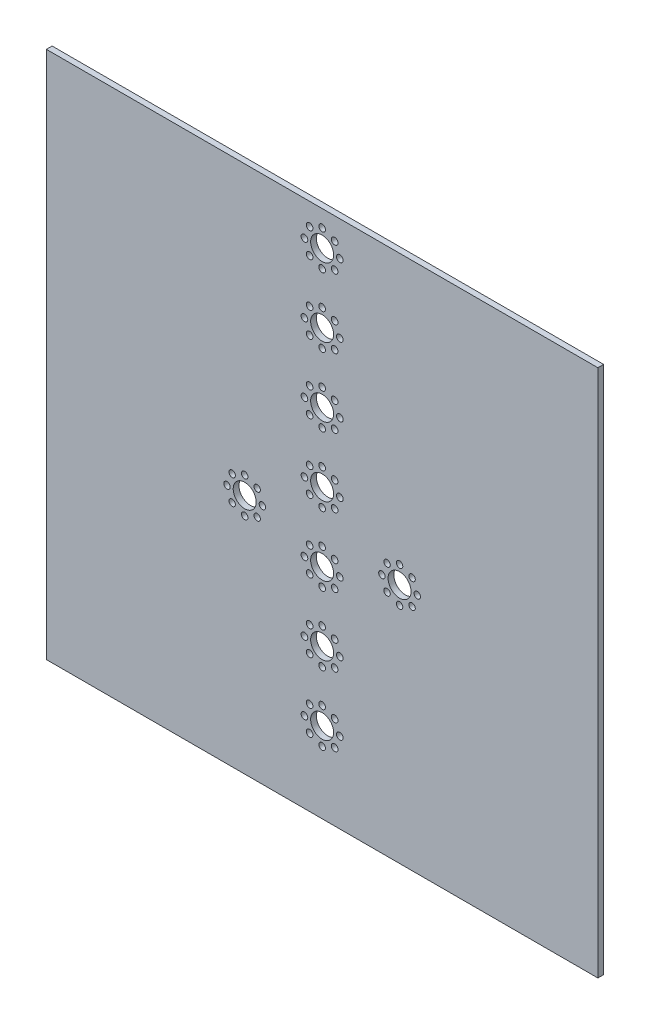
from build123d import *

# Parameters (mm, degrees)
SKETCH1_W                  = 304.8
SKETCH1_H                  = 292.1
BOSS_EXTRUDE1_DEPTH        = 3.175
SKETCH2_R                  = 1.778
CUT_EXTRUDE1_DEPTH         = 3.175
SKETCH3_R                  = 6.35
CUT_EXTRUDE2_DEPTH         = 3.175
CIRPATTERN1_COUNT          = 8
MIRROR2_COPY_1_SKETCH_R    = 1.778
MIRROR2_COPY_1_DEPTH       = 3.175
MIRROR2_COPY_2_SKETCH_R    = 1.778
MIRROR2_COPY_2_DEPTH       = 3.175
MIRROR2_COPY_3_SKETCH_R    = 1.778
MIRROR2_COPY_3_DEPTH       = 3.175
MIRROR2_COPY_4_SKETCH_R    = 1.778
MIRROR2_COPY_4_DEPTH       = 3.175
MIRROR2_COPY_5_SKETCH_R    = 1.778
MIRROR2_COPY_5_DEPTH       = 3.175
MIRROR2_COPY_6_SKETCH_R    = 1.778
MIRROR2_COPY_6_DEPTH       = 3.175
MIRROR2_COPY_7_SKETCH_R    = 1.778
MIRROR2_COPY_7_DEPTH       = 3.175
MIRROR2_COPY_8_SKETCH_R    = 1.778
MIRROR2_COPY_8_DEPTH       = 3.175
SKETCH4_R                  = 6.35
CUT_EXTRUDE3_DEPTH         = 3.175
SKETCH5_R                  = 1.8415
CUT_EXTRUDE4_DEPTH         = 3.175
CIRPATTERN2_COUNT          = 8
LPATTERN1_COUNT            = 7
LPATTERN1_PITCH            = 38.1
LPATTERN1_COPY_1_SKETCH_R  = 1.8415
LPATTERN1_COPY_1_DEPTH     = 3.175
LPATTERN1_COPY_2_SKETCH_R  = 1.8415
LPATTERN1_COPY_2_DEPTH     = 3.175
LPATTERN1_COPY_3_SKETCH_R  = 1.8415
LPATTERN1_COPY_3_DEPTH     = 3.175
LPATTERN1_COPY_4_SKETCH_R  = 1.8415
LPATTERN1_COPY_4_DEPTH     = 3.175
LPATTERN1_COPY_5_SKETCH_R  = 1.8415
LPATTERN1_COPY_5_DEPTH     = 3.175
LPATTERN1_COPY_6_SKETCH_R  = 1.8415
LPATTERN1_COPY_6_DEPTH     = 3.175
LPATTERN1_COPY_7_SKETCH_R  = 1.8415
LPATTERN1_COPY_7_DEPTH     = 3.175
LPATTERN1_COPY_8_SKETCH_R  = 1.8415
LPATTERN1_COPY_8_DEPTH     = 3.175
LPATTERN1_COPY_9_SKETCH_R  = 1.8415
LPATTERN1_COPY_9_DEPTH     = 3.175
LPATTERN1_COPY_10_SKETCH_R = 1.8415
LPATTERN1_COPY_10_DEPTH    = 3.175
LPATTERN1_COPY_11_SKETCH_R = 1.8415
LPATTERN1_COPY_11_DEPTH    = 3.175
LPATTERN1_COPY_12_SKETCH_R = 1.8415
LPATTERN1_COPY_12_DEPTH    = 3.175
LPATTERN1_COPY_13_SKETCH_R = 1.8415
LPATTERN1_COPY_13_DEPTH    = 3.175
LPATTERN1_COPY_14_SKETCH_R = 1.8415
LPATTERN1_COPY_14_DEPTH    = 3.175
LPATTERN1_COPY_15_SKETCH_R = 1.8415
LPATTERN1_COPY_15_DEPTH    = 3.175
LPATTERN1_COPY_16_SKETCH_R = 1.8415
LPATTERN1_COPY_16_DEPTH    = 3.175
LPATTERN1_COPY_17_SKETCH_R = 1.8415
LPATTERN1_COPY_17_DEPTH    = 3.175
LPATTERN1_COPY_18_SKETCH_R = 1.8415
LPATTERN1_COPY_18_DEPTH    = 3.175
LPATTERN1_COPY_19_SKETCH_R = 1.8415
LPATTERN1_COPY_19_DEPTH    = 3.175
LPATTERN1_COPY_20_SKETCH_R = 1.8415
LPATTERN1_COPY_20_DEPTH    = 3.175
LPATTERN1_COPY_21_SKETCH_R = 1.8415
LPATTERN1_COPY_21_DEPTH    = 3.175
LPATTERN1_COPY_22_SKETCH_R = 1.8415
LPATTERN1_COPY_22_DEPTH    = 3.175
LPATTERN1_COPY_23_SKETCH_R = 1.8415
LPATTERN1_COPY_23_DEPTH    = 3.175
LPATTERN1_COPY_24_SKETCH_R = 1.8415
LPATTERN1_COPY_24_DEPTH    = 3.175
LPATTERN1_COPY_25_SKETCH_R = 1.8415
LPATTERN1_COPY_25_DEPTH    = 3.175
LPATTERN1_COPY_26_SKETCH_R = 1.8415
LPATTERN1_COPY_26_DEPTH    = 3.175
LPATTERN1_COPY_27_SKETCH_R = 1.8415
LPATTERN1_COPY_27_DEPTH    = 3.175
LPATTERN1_COPY_28_SKETCH_R = 1.8415
LPATTERN1_COPY_28_DEPTH    = 3.175
LPATTERN1_COPY_29_SKETCH_R = 1.8415
LPATTERN1_COPY_29_DEPTH    = 3.175
LPATTERN1_COPY_30_SKETCH_R = 1.8415
LPATTERN1_COPY_30_DEPTH    = 3.175
LPATTERN1_COPY_31_SKETCH_R = 1.8415
LPATTERN1_COPY_31_DEPTH    = 3.175
LPATTERN1_COPY_32_SKETCH_R = 1.8415
LPATTERN1_COPY_32_DEPTH    = 3.175
LPATTERN1_COPY_33_SKETCH_R = 1.8415
LPATTERN1_COPY_33_DEPTH    = 3.175
LPATTERN1_COPY_34_SKETCH_R = 1.8415
LPATTERN1_COPY_34_DEPTH    = 3.175
LPATTERN1_COPY_35_SKETCH_R = 1.8415
LPATTERN1_COPY_35_DEPTH    = 3.175
LPATTERN1_COPY_36_SKETCH_R = 1.8415
LPATTERN1_COPY_36_DEPTH    = 3.175
LPATTERN1_COPY_37_SKETCH_R = 1.8415
LPATTERN1_COPY_37_DEPTH    = 3.175
LPATTERN1_COPY_38_SKETCH_R = 1.8415
LPATTERN1_COPY_38_DEPTH    = 3.175
LPATTERN1_COPY_39_SKETCH_R = 1.8415
LPATTERN1_COPY_39_DEPTH    = 3.175
LPATTERN1_COPY_40_SKETCH_R = 1.8415
LPATTERN1_COPY_40_DEPTH    = 3.175
LPATTERN1_COPY_41_SKETCH_R = 1.8415
LPATTERN1_COPY_41_DEPTH    = 3.175
LPATTERN1_COPY_42_SKETCH_R = 1.8415
LPATTERN1_COPY_42_DEPTH    = 3.175
LPATTERN1_COPY_43_SKETCH_R = 1.8415
LPATTERN1_COPY_43_DEPTH    = 3.175
LPATTERN1_COPY_44_SKETCH_R = 1.8415
LPATTERN1_COPY_44_DEPTH    = 3.175
LPATTERN1_COPY_45_SKETCH_R = 1.8415
LPATTERN1_COPY_45_DEPTH    = 3.175
LPATTERN1_COPY_46_SKETCH_R = 1.8415
LPATTERN1_COPY_46_DEPTH    = 3.175
LPATTERN1_COPY_47_SKETCH_R = 1.8415
LPATTERN1_COPY_47_DEPTH    = 3.175
LPATTERN1_COPY_48_SKETCH_R = 1.8415
LPATTERN1_COPY_48_DEPTH    = 3.175


with BuildPart() as part:
    # Sketch1 → Boss-Extrude1 (new body)
    with BuildSketch(Plane.XY):
        with Locations((-152.4, -146.05)):
            Rectangle(SKETCH1_W, SKETCH1_H)
    extrude(amount=BOSS_EXTRUDE1_DEPTH)

    # Sketch2 → Cut-Extrude1 (cut)
    with BuildSketch(Plane(origin=(0, 0, 0), x_dir=(-1, 0, 0), z_dir=(0, 0, -1))):
        with Locations((99.822, -158.75)):
            Circle(SKETCH2_R)
    cut_extrude1 = extrude(amount=-CUT_EXTRUDE1_DEPTH, mode=Mode.SUBTRACT)

    # Mirror1: Cut-Extrude1 across plane
    add(cut_extrude1.mirror(Plane(origin=(-152.4, 0, 0), x_dir=(0, 0, 1), z_dir=(1, 0, 0))), mode=Mode.SUBTRACT)

    # Sketch3 → Cut-Extrude2 (cut)
    with BuildSketch(Plane(origin=(0, 0, 0), x_dir=(-1, 0, 0), z_dir=(0, 0, -1))):
        with Locations((109.601, -158.75)):
            Circle(SKETCH3_R)
    cut_extrude2 = extrude(amount=-CUT_EXTRUDE2_DEPTH, mode=Mode.SUBTRACT)

    # CirPattern1: Cut-Extrude1 ×8 about axis
    cirpattern1_axis = Axis((-109.601, -158.75, 0), (0, 0, -1))
    for i in range(1, CIRPATTERN1_COUNT):
        add(cut_extrude1.rotate(cirpattern1_axis, i * 360 / CIRPATTERN1_COUNT), mode=Mode.SUBTRACT)

    # Mirror2: Cut-Extrude2 across plane
    add(cut_extrude2.mirror(Plane(origin=(-152.4, 0, 0), x_dir=(0, 0, 1), z_dir=(1, 0, 0))), mode=Mode.SUBTRACT)

    # Mirror2 copy 1 sketch → Mirror2 copy 1 (cut)
    with BuildSketch(Plane(origin=(-384.951811838, -123.996408811, 0), x_dir=(0.7071067811865478, 0.7071067811865472, 0), z_dir=(0, 0, -1))):
        with Locations((99.822, 158.75)):
            Circle(MIRROR2_COPY_1_SKETCH_R)
    extrude(amount=-MIRROR2_COPY_1_DEPTH, mode=Mode.SUBTRACT)

    # Mirror2 copy 2 sketch → Mirror2 copy 2 (cut)
    with BuildSketch(Plane(origin=(-353.949, -268.351, 0), x_dir=(0, 1, 0), z_dir=(0, 0, -1))):
        with Locations((99.822, 158.75)):
            Circle(MIRROR2_COPY_2_SKETCH_R)
    extrude(amount=-MIRROR2_COPY_2_DEPTH, mode=Mode.SUBTRACT)

    # Mirror2 copy 3 sketch → Mirror2 copy 3 (cut)
    with BuildSketch(Plane(origin=(-229.952591189, -348.502811838, 0), x_dir=(-0.7071067811865472, 0.7071067811865478, 0), z_dir=(0, 0, -1))):
        with Locations((99.822, 158.75)):
            Circle(MIRROR2_COPY_3_SKETCH_R)
    extrude(amount=-MIRROR2_COPY_3_DEPTH, mode=Mode.SUBTRACT)

    # Mirror2 copy 4 sketch → Mirror2 copy 4 (cut)
    with BuildSketch(Plane(origin=(-85.598, -317.5, 0), x_dir=(-1, 0, 0), z_dir=(0, 0, -1))):
        with Locations((99.822, 158.75)):
            Circle(MIRROR2_COPY_4_SKETCH_R)
    extrude(amount=-MIRROR2_COPY_4_DEPTH, mode=Mode.SUBTRACT)

    # Mirror2 copy 5 sketch → Mirror2 copy 5 (cut)
    with BuildSketch(Plane(origin=(-5.446188162, -193.503591189, 0), x_dir=(-0.7071067811865479, -0.7071067811865472, 0), z_dir=(0, 0, -1))):
        with Locations((99.822, 158.75)):
            Circle(MIRROR2_COPY_5_SKETCH_R)
    extrude(amount=-MIRROR2_COPY_5_DEPTH, mode=Mode.SUBTRACT)

    # Mirror2 copy 6 sketch → Mirror2 copy 6 (cut)
    with BuildSketch(Plane(origin=(-36.449, -49.149, 0), x_dir=(0, -1, 0), z_dir=(0, 0, -1))):
        with Locations((99.822, 158.75)):
            Circle(MIRROR2_COPY_6_SKETCH_R)
    extrude(amount=-MIRROR2_COPY_6_DEPTH, mode=Mode.SUBTRACT)

    # Mirror2 copy 7 sketch → Mirror2 copy 7 (cut)
    with BuildSketch(Plane(origin=(-160.445408811, 31.002811838, 0), x_dir=(0.7071067811865471, -0.7071067811865479, 0), z_dir=(0, 0, -1))):
        with Locations((99.822, 158.75)):
            Circle(MIRROR2_COPY_7_SKETCH_R)
    extrude(amount=-MIRROR2_COPY_7_DEPTH, mode=Mode.SUBTRACT)

    # Mirror2 copy 8 sketch → Mirror2 copy 8 (cut)
    with BuildSketch(Plane(origin=(-304.8, 0, 0), x_dir=(1, 0, 0), z_dir=(0, 0, -1))):
        with Locations((99.822, 158.75)):
            Circle(MIRROR2_COPY_8_SKETCH_R)
    extrude(amount=-MIRROR2_COPY_8_DEPTH, mode=Mode.SUBTRACT)

    # Sketch4 → Cut-Extrude3 (cut)
    with BuildSketch(Plane(origin=(0, 0, 0), x_dir=(-1, 0, 0), z_dir=(0, 0, -1))):
        with Locations((152.4, -19.05)):
            Circle(SKETCH4_R)
    cut_extrude3 = extrude(amount=-CUT_EXTRUDE3_DEPTH, mode=Mode.SUBTRACT)

    # Sketch5 → Cut-Extrude4 (cut)
    with BuildSketch(Plane(origin=(0, 0, 0), x_dir=(-1, 0, 0), z_dir=(0, 0, -1))):
        with Locations((152.4, -9.271)):
            Circle(SKETCH5_R)
    cut_extrude4 = extrude(amount=-CUT_EXTRUDE4_DEPTH, mode=Mode.SUBTRACT)

    # CirPattern2: Cut-Extrude4 ×8 about axis
    cirpattern2_axis = Axis((-152.4, -19.05, 0), (0, 0, -1))
    for i in range(1, CIRPATTERN2_COUNT):
        add(cut_extrude4.rotate(cirpattern2_axis, i * 360 / CIRPATTERN2_COUNT), mode=Mode.SUBTRACT)

    # LPattern1: Cut-Extrude3 ×7
    with Locations(*[(0, -i * LPATTERN1_PITCH, 0) for i in range(1, LPATTERN1_COUNT)]):
        add(cut_extrude3, mode=Mode.SUBTRACT)

    # LPattern1 copy 1 sketch → LPattern1 copy 1 (cut)
    with BuildSketch(Plane(origin=(-31.166542366, -151.442689271, 0), x_dir=(-0.7071067811865476, 0.7071067811865475, 0), z_dir=(0, 0, -1))):
        with Locations((152.4, -9.271)):
            Circle(LPATTERN1_COPY_1_SKETCH_R)
    extrude(amount=-LPATTERN1_COPY_1_DEPTH, mode=Mode.SUBTRACT)

    # LPattern1 copy 2 sketch → LPattern1 copy 2 (cut)
    with BuildSketch(Plane(origin=(-31.166542366, -189.542689271, 0), x_dir=(-0.7071067811865476, 0.7071067811865475, 0), z_dir=(0, 0, -1))):
        with Locations((152.4, -9.271)):
            Circle(LPATTERN1_COPY_2_SKETCH_R)
    extrude(amount=-LPATTERN1_COPY_2_DEPTH, mode=Mode.SUBTRACT)

    # LPattern1 copy 3 sketch → LPattern1 copy 3 (cut)
    with BuildSketch(Plane(origin=(-31.166542366, -227.642689271, 0), x_dir=(-0.7071067811865476, 0.7071067811865475, 0), z_dir=(0, 0, -1))):
        with Locations((152.4, -9.271)):
            Circle(LPATTERN1_COPY_3_SKETCH_R)
    extrude(amount=-LPATTERN1_COPY_3_DEPTH, mode=Mode.SUBTRACT)

    # LPattern1 copy 4 sketch → LPattern1 copy 4 (cut)
    with BuildSketch(Plane(origin=(-31.166542366, -265.742689271, 0), x_dir=(-0.7071067811865476, 0.7071067811865475, 0), z_dir=(0, 0, -1))):
        with Locations((152.4, -9.271)):
            Circle(LPATTERN1_COPY_4_SKETCH_R)
    extrude(amount=-LPATTERN1_COPY_4_DEPTH, mode=Mode.SUBTRACT)

    # LPattern1 copy 5 sketch → LPattern1 copy 5 (cut)
    with BuildSketch(Plane(origin=(-31.166542366, -303.842689271, 0), x_dir=(-0.7071067811865476, 0.7071067811865475, 0), z_dir=(0, 0, -1))):
        with Locations((152.4, -9.271)):
            Circle(LPATTERN1_COPY_5_SKETCH_R)
    extrude(amount=-LPATTERN1_COPY_5_DEPTH, mode=Mode.SUBTRACT)

    # LPattern1 copy 6 sketch → LPattern1 copy 6 (cut)
    with BuildSketch(Plane(origin=(-31.166542366, -341.942689271, 0), x_dir=(-0.7071067811865476, 0.7071067811865475, 0), z_dir=(0, 0, -1))):
        with Locations((152.4, -9.271)):
            Circle(LPATTERN1_COPY_6_SKETCH_R)
    extrude(amount=-LPATTERN1_COPY_6_DEPTH, mode=Mode.SUBTRACT)

    # LPattern1 copy 7 sketch → LPattern1 copy 7 (cut)
    with BuildSketch(Plane(origin=(-133.35, -209.55, 0), x_dir=(0, 1, 0), z_dir=(0, 0, -1))):
        with Locations((152.4, -9.271)):
            Circle(LPATTERN1_COPY_7_SKETCH_R)
    extrude(amount=-LPATTERN1_COPY_7_DEPTH, mode=Mode.SUBTRACT)

    # LPattern1 copy 8 sketch → LPattern1 copy 8 (cut)
    with BuildSketch(Plane(origin=(-133.35, -247.65, 0), x_dir=(0, 1, 0), z_dir=(0, 0, -1))):
        with Locations((152.4, -9.271)):
            Circle(LPATTERN1_COPY_8_SKETCH_R)
    extrude(amount=-LPATTERN1_COPY_8_DEPTH, mode=Mode.SUBTRACT)

    # LPattern1 copy 9 sketch → LPattern1 copy 9 (cut)
    with BuildSketch(Plane(origin=(-133.35, -285.75, 0), x_dir=(0, 1, 0), z_dir=(0, 0, -1))):
        with Locations((152.4, -9.271)):
            Circle(LPATTERN1_COPY_9_SKETCH_R)
    extrude(amount=-LPATTERN1_COPY_9_DEPTH, mode=Mode.SUBTRACT)

    # LPattern1 copy 10 sketch → LPattern1 copy 10 (cut)
    with BuildSketch(Plane(origin=(-133.35, -323.85, 0), x_dir=(0, 1, 0), z_dir=(0, 0, -1))):
        with Locations((152.4, -9.271)):
            Circle(LPATTERN1_COPY_10_SKETCH_R)
    extrude(amount=-LPATTERN1_COPY_10_DEPTH, mode=Mode.SUBTRACT)

    # LPattern1 copy 11 sketch → LPattern1 copy 11 (cut)
    with BuildSketch(Plane(origin=(-133.35, -361.95, 0), x_dir=(0, 1, 0), z_dir=(0, 0, -1))):
        with Locations((152.4, -9.271)):
            Circle(LPATTERN1_COPY_11_SKETCH_R)
    extrude(amount=-LPATTERN1_COPY_11_DEPTH, mode=Mode.SUBTRACT)

    # LPattern1 copy 12 sketch → LPattern1 copy 12 (cut)
    with BuildSketch(Plane(origin=(-133.35, -400.05, 0), x_dir=(0, 1, 0), z_dir=(0, 0, -1))):
        with Locations((152.4, -9.271)):
            Circle(LPATTERN1_COPY_12_SKETCH_R)
    extrude(amount=-LPATTERN1_COPY_12_DEPTH, mode=Mode.SUBTRACT)

    # LPattern1 copy 13 sketch → LPattern1 copy 13 (cut)
    with BuildSketch(Plane(origin=(-246.692689271, -178.383457634, 0), x_dir=(0.7071067811865475, 0.7071067811865476, 0), z_dir=(0, 0, -1))):
        with Locations((152.4, -9.271)):
            Circle(LPATTERN1_COPY_13_SKETCH_R)
    extrude(amount=-LPATTERN1_COPY_13_DEPTH, mode=Mode.SUBTRACT)

    # LPattern1 copy 14 sketch → LPattern1 copy 14 (cut)
    with BuildSketch(Plane(origin=(-246.692689271, -216.483457634, 0), x_dir=(0.7071067811865475, 0.7071067811865476, 0), z_dir=(0, 0, -1))):
        with Locations((152.4, -9.271)):
            Circle(LPATTERN1_COPY_14_SKETCH_R)
    extrude(amount=-LPATTERN1_COPY_14_DEPTH, mode=Mode.SUBTRACT)

    # LPattern1 copy 15 sketch → LPattern1 copy 15 (cut)
    with BuildSketch(Plane(origin=(-246.692689271, -254.583457634, 0), x_dir=(0.7071067811865475, 0.7071067811865476, 0), z_dir=(0, 0, -1))):
        with Locations((152.4, -9.271)):
            Circle(LPATTERN1_COPY_15_SKETCH_R)
    extrude(amount=-LPATTERN1_COPY_15_DEPTH, mode=Mode.SUBTRACT)

    # LPattern1 copy 16 sketch → LPattern1 copy 16 (cut)
    with BuildSketch(Plane(origin=(-246.692689271, -292.683457634, 0), x_dir=(0.7071067811865475, 0.7071067811865476, 0), z_dir=(0, 0, -1))):
        with Locations((152.4, -9.271)):
            Circle(LPATTERN1_COPY_16_SKETCH_R)
    extrude(amount=-LPATTERN1_COPY_16_DEPTH, mode=Mode.SUBTRACT)

    # LPattern1 copy 17 sketch → LPattern1 copy 17 (cut)
    with BuildSketch(Plane(origin=(-246.692689271, -330.783457634, 0), x_dir=(0.7071067811865475, 0.7071067811865476, 0), z_dir=(0, 0, -1))):
        with Locations((152.4, -9.271)):
            Circle(LPATTERN1_COPY_17_SKETCH_R)
    extrude(amount=-LPATTERN1_COPY_17_DEPTH, mode=Mode.SUBTRACT)

    # LPattern1 copy 18 sketch → LPattern1 copy 18 (cut)
    with BuildSketch(Plane(origin=(-246.692689271, -368.883457634, 0), x_dir=(0.7071067811865475, 0.7071067811865476, 0), z_dir=(0, 0, -1))):
        with Locations((152.4, -9.271)):
            Circle(LPATTERN1_COPY_18_SKETCH_R)
    extrude(amount=-LPATTERN1_COPY_18_DEPTH, mode=Mode.SUBTRACT)

    # LPattern1 copy 19 sketch → LPattern1 copy 19 (cut)
    with BuildSketch(Plane(origin=(-304.8, -76.2, 0), x_dir=(1, 0, 0), z_dir=(0, 0, -1))):
        with Locations((152.4, -9.271)):
            Circle(LPATTERN1_COPY_19_SKETCH_R)
    extrude(amount=-LPATTERN1_COPY_19_DEPTH, mode=Mode.SUBTRACT)

    # LPattern1 copy 20 sketch → LPattern1 copy 20 (cut)
    with BuildSketch(Plane(origin=(-304.8, -114.3, 0), x_dir=(1, 0, 0), z_dir=(0, 0, -1))):
        with Locations((152.4, -9.271)):
            Circle(LPATTERN1_COPY_20_SKETCH_R)
    extrude(amount=-LPATTERN1_COPY_20_DEPTH, mode=Mode.SUBTRACT)

    # LPattern1 copy 21 sketch → LPattern1 copy 21 (cut)
    with BuildSketch(Plane(origin=(-304.8, -152.4, 0), x_dir=(1, 0, 0), z_dir=(0, 0, -1))):
        with Locations((152.4, -9.271)):
            Circle(LPATTERN1_COPY_21_SKETCH_R)
    extrude(amount=-LPATTERN1_COPY_21_DEPTH, mode=Mode.SUBTRACT)

    # LPattern1 copy 22 sketch → LPattern1 copy 22 (cut)
    with BuildSketch(Plane(origin=(-304.8, -190.5, 0), x_dir=(1, 0, 0), z_dir=(0, 0, -1))):
        with Locations((152.4, -9.271)):
            Circle(LPATTERN1_COPY_22_SKETCH_R)
    extrude(amount=-LPATTERN1_COPY_22_DEPTH, mode=Mode.SUBTRACT)

    # LPattern1 copy 23 sketch → LPattern1 copy 23 (cut)
    with BuildSketch(Plane(origin=(-304.8, -228.6, 0), x_dir=(1, 0, 0), z_dir=(0, 0, -1))):
        with Locations((152.4, -9.271)):
            Circle(LPATTERN1_COPY_23_SKETCH_R)
    extrude(amount=-LPATTERN1_COPY_23_DEPTH, mode=Mode.SUBTRACT)

    # LPattern1 copy 24 sketch → LPattern1 copy 24 (cut)
    with BuildSketch(Plane(origin=(-304.8, -266.7, 0), x_dir=(1, 0, 0), z_dir=(0, 0, -1))):
        with Locations((152.4, -9.271)):
            Circle(LPATTERN1_COPY_24_SKETCH_R)
    extrude(amount=-LPATTERN1_COPY_24_DEPTH, mode=Mode.SUBTRACT)

    # LPattern1 copy 25 sketch → LPattern1 copy 25 (cut)
    with BuildSketch(Plane(origin=(-273.633457634, 37.142689271, 0), x_dir=(0.7071067811865477, -0.7071067811865475, 0), z_dir=(0, 0, -1))):
        with Locations((152.4, -9.271)):
            Circle(LPATTERN1_COPY_25_SKETCH_R)
    extrude(amount=-LPATTERN1_COPY_25_DEPTH, mode=Mode.SUBTRACT)

    # LPattern1 copy 26 sketch → LPattern1 copy 26 (cut)
    with BuildSketch(Plane(origin=(-273.633457634, -0.957310729, 0), x_dir=(0.7071067811865477, -0.7071067811865475, 0), z_dir=(0, 0, -1))):
        with Locations((152.4, -9.271)):
            Circle(LPATTERN1_COPY_26_SKETCH_R)
    extrude(amount=-LPATTERN1_COPY_26_DEPTH, mode=Mode.SUBTRACT)

    # LPattern1 copy 27 sketch → LPattern1 copy 27 (cut)
    with BuildSketch(Plane(origin=(-273.633457634, -39.057310729, 0), x_dir=(0.7071067811865477, -0.7071067811865475, 0), z_dir=(0, 0, -1))):
        with Locations((152.4, -9.271)):
            Circle(LPATTERN1_COPY_27_SKETCH_R)
    extrude(amount=-LPATTERN1_COPY_27_DEPTH, mode=Mode.SUBTRACT)

    # LPattern1 copy 28 sketch → LPattern1 copy 28 (cut)
    with BuildSketch(Plane(origin=(-273.633457634, -77.157310729, 0), x_dir=(0.7071067811865477, -0.7071067811865475, 0), z_dir=(0, 0, -1))):
        with Locations((152.4, -9.271)):
            Circle(LPATTERN1_COPY_28_SKETCH_R)
    extrude(amount=-LPATTERN1_COPY_28_DEPTH, mode=Mode.SUBTRACT)

    # LPattern1 copy 29 sketch → LPattern1 copy 29 (cut)
    with BuildSketch(Plane(origin=(-273.633457634, -115.257310729, 0), x_dir=(0.7071067811865477, -0.7071067811865475, 0), z_dir=(0, 0, -1))):
        with Locations((152.4, -9.271)):
            Circle(LPATTERN1_COPY_29_SKETCH_R)
    extrude(amount=-LPATTERN1_COPY_29_DEPTH, mode=Mode.SUBTRACT)

    # LPattern1 copy 30 sketch → LPattern1 copy 30 (cut)
    with BuildSketch(Plane(origin=(-273.633457634, -153.357310729, 0), x_dir=(0.7071067811865477, -0.7071067811865475, 0), z_dir=(0, 0, -1))):
        with Locations((152.4, -9.271)):
            Circle(LPATTERN1_COPY_30_SKETCH_R)
    extrude(amount=-LPATTERN1_COPY_30_DEPTH, mode=Mode.SUBTRACT)

    # LPattern1 copy 31 sketch → LPattern1 copy 31 (cut)
    with BuildSketch(Plane(origin=(-171.45, 95.25, 0), x_dir=(0, -1, 0), z_dir=(0, 0, -1))):
        with Locations((152.4, -9.271)):
            Circle(LPATTERN1_COPY_31_SKETCH_R)
    extrude(amount=-LPATTERN1_COPY_31_DEPTH, mode=Mode.SUBTRACT)

    # LPattern1 copy 32 sketch → LPattern1 copy 32 (cut)
    with BuildSketch(Plane(origin=(-171.45, 57.15, 0), x_dir=(0, -1, 0), z_dir=(0, 0, -1))):
        with Locations((152.4, -9.271)):
            Circle(LPATTERN1_COPY_32_SKETCH_R)
    extrude(amount=-LPATTERN1_COPY_32_DEPTH, mode=Mode.SUBTRACT)

    # LPattern1 copy 33 sketch → LPattern1 copy 33 (cut)
    with BuildSketch(Plane(origin=(-171.45, 19.05, 0), x_dir=(0, -1, 0), z_dir=(0, 0, -1))):
        with Locations((152.4, -9.271)):
            Circle(LPATTERN1_COPY_33_SKETCH_R)
    extrude(amount=-LPATTERN1_COPY_33_DEPTH, mode=Mode.SUBTRACT)

    # LPattern1 copy 34 sketch → LPattern1 copy 34 (cut)
    with BuildSketch(Plane(origin=(-171.45, -19.05, 0), x_dir=(0, -1, 0), z_dir=(0, 0, -1))):
        with Locations((152.4, -9.271)):
            Circle(LPATTERN1_COPY_34_SKETCH_R)
    extrude(amount=-LPATTERN1_COPY_34_DEPTH, mode=Mode.SUBTRACT)

    # LPattern1 copy 35 sketch → LPattern1 copy 35 (cut)
    with BuildSketch(Plane(origin=(-171.45, -57.15, 0), x_dir=(0, -1, 0), z_dir=(0, 0, -1))):
        with Locations((152.4, -9.271)):
            Circle(LPATTERN1_COPY_35_SKETCH_R)
    extrude(amount=-LPATTERN1_COPY_35_DEPTH, mode=Mode.SUBTRACT)

    # LPattern1 copy 36 sketch → LPattern1 copy 36 (cut)
    with BuildSketch(Plane(origin=(-171.45, -95.25, 0), x_dir=(0, -1, 0), z_dir=(0, 0, -1))):
        with Locations((152.4, -9.271)):
            Circle(LPATTERN1_COPY_36_SKETCH_R)
    extrude(amount=-LPATTERN1_COPY_36_DEPTH, mode=Mode.SUBTRACT)

    # LPattern1 copy 37 sketch → LPattern1 copy 37 (cut)
    with BuildSketch(Plane(origin=(-58.107310729, 64.083457634, 0), x_dir=(-0.7071067811865474, -0.7071067811865477, 0), z_dir=(0, 0, -1))):
        with Locations((152.4, -9.271)):
            Circle(LPATTERN1_COPY_37_SKETCH_R)
    extrude(amount=-LPATTERN1_COPY_37_DEPTH, mode=Mode.SUBTRACT)

    # LPattern1 copy 38 sketch → LPattern1 copy 38 (cut)
    with BuildSketch(Plane(origin=(-58.107310729, 25.983457634, 0), x_dir=(-0.7071067811865474, -0.7071067811865477, 0), z_dir=(0, 0, -1))):
        with Locations((152.4, -9.271)):
            Circle(LPATTERN1_COPY_38_SKETCH_R)
    extrude(amount=-LPATTERN1_COPY_38_DEPTH, mode=Mode.SUBTRACT)

    # LPattern1 copy 39 sketch → LPattern1 copy 39 (cut)
    with BuildSketch(Plane(origin=(-58.107310729, -12.116542366, 0), x_dir=(-0.7071067811865474, -0.7071067811865477, 0), z_dir=(0, 0, -1))):
        with Locations((152.4, -9.271)):
            Circle(LPATTERN1_COPY_39_SKETCH_R)
    extrude(amount=-LPATTERN1_COPY_39_DEPTH, mode=Mode.SUBTRACT)

    # LPattern1 copy 40 sketch → LPattern1 copy 40 (cut)
    with BuildSketch(Plane(origin=(-58.107310729, -50.216542366, 0), x_dir=(-0.7071067811865474, -0.7071067811865477, 0), z_dir=(0, 0, -1))):
        with Locations((152.4, -9.271)):
            Circle(LPATTERN1_COPY_40_SKETCH_R)
    extrude(amount=-LPATTERN1_COPY_40_DEPTH, mode=Mode.SUBTRACT)

    # LPattern1 copy 41 sketch → LPattern1 copy 41 (cut)
    with BuildSketch(Plane(origin=(-58.107310729, -88.316542366, 0), x_dir=(-0.7071067811865474, -0.7071067811865477, 0), z_dir=(0, 0, -1))):
        with Locations((152.4, -9.271)):
            Circle(LPATTERN1_COPY_41_SKETCH_R)
    extrude(amount=-LPATTERN1_COPY_41_DEPTH, mode=Mode.SUBTRACT)

    # LPattern1 copy 42 sketch → LPattern1 copy 42 (cut)
    with BuildSketch(Plane(origin=(-58.107310729, -126.416542366, 0), x_dir=(-0.7071067811865474, -0.7071067811865477, 0), z_dir=(0, 0, -1))):
        with Locations((152.4, -9.271)):
            Circle(LPATTERN1_COPY_42_SKETCH_R)
    extrude(amount=-LPATTERN1_COPY_42_DEPTH, mode=Mode.SUBTRACT)

    # LPattern1 copy 43 sketch → LPattern1 copy 43 (cut)
    with BuildSketch(Plane(origin=(0, -38.1, 0), x_dir=(-1, 0, 0), z_dir=(0, 0, -1))):
        with Locations((152.4, -9.271)):
            Circle(LPATTERN1_COPY_43_SKETCH_R)
    extrude(amount=-LPATTERN1_COPY_43_DEPTH, mode=Mode.SUBTRACT)

    # LPattern1 copy 44 sketch → LPattern1 copy 44 (cut)
    with BuildSketch(Plane(origin=(0, -76.2, 0), x_dir=(-1, 0, 0), z_dir=(0, 0, -1))):
        with Locations((152.4, -9.271)):
            Circle(LPATTERN1_COPY_44_SKETCH_R)
    extrude(amount=-LPATTERN1_COPY_44_DEPTH, mode=Mode.SUBTRACT)

    # LPattern1 copy 45 sketch → LPattern1 copy 45 (cut)
    with BuildSketch(Plane(origin=(0, -114.3, 0), x_dir=(-1, 0, 0), z_dir=(0, 0, -1))):
        with Locations((152.4, -9.271)):
            Circle(LPATTERN1_COPY_45_SKETCH_R)
    extrude(amount=-LPATTERN1_COPY_45_DEPTH, mode=Mode.SUBTRACT)

    # LPattern1 copy 46 sketch → LPattern1 copy 46 (cut)
    with BuildSketch(Plane(origin=(0, -152.4, 0), x_dir=(-1, 0, 0), z_dir=(0, 0, -1))):
        with Locations((152.4, -9.271)):
            Circle(LPATTERN1_COPY_46_SKETCH_R)
    extrude(amount=-LPATTERN1_COPY_46_DEPTH, mode=Mode.SUBTRACT)

    # LPattern1 copy 47 sketch → LPattern1 copy 47 (cut)
    with BuildSketch(Plane(origin=(0, -190.5, 0), x_dir=(-1, 0, 0), z_dir=(0, 0, -1))):
        with Locations((152.4, -9.271)):
            Circle(LPATTERN1_COPY_47_SKETCH_R)
    extrude(amount=-LPATTERN1_COPY_47_DEPTH, mode=Mode.SUBTRACT)

    # LPattern1 copy 48 sketch → LPattern1 copy 48 (cut)
    with BuildSketch(Plane(origin=(0, -228.6, 0), x_dir=(-1, 0, 0), z_dir=(0, 0, -1))):
        with Locations((152.4, -9.271)):
            Circle(LPATTERN1_COPY_48_SKETCH_R)
    extrude(amount=-LPATTERN1_COPY_48_DEPTH, mode=Mode.SUBTRACT)


solid = part.part
